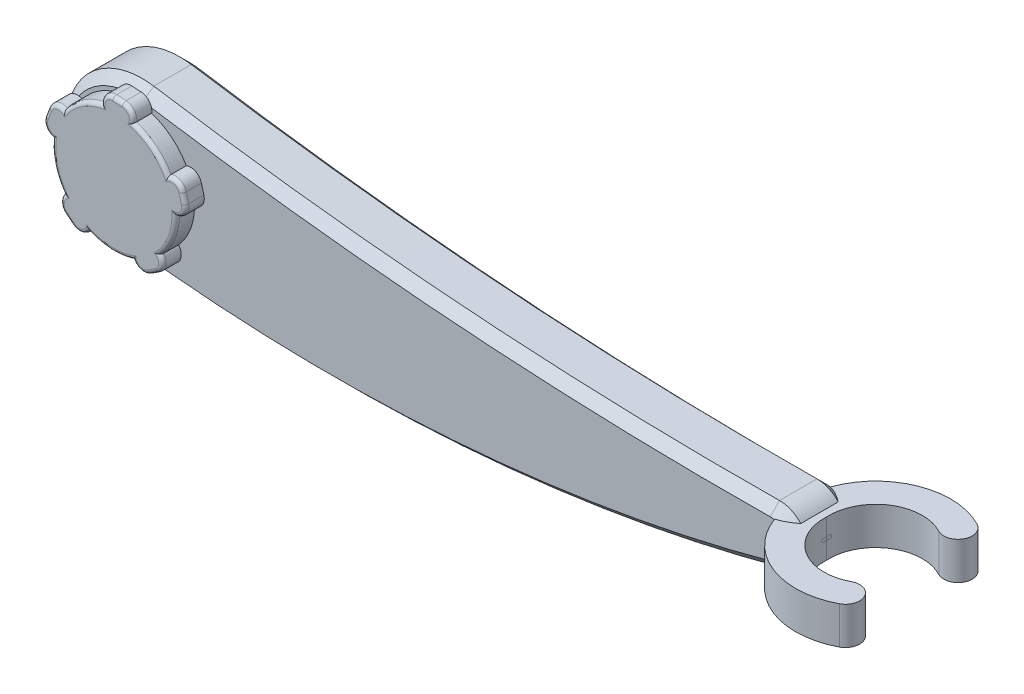
from build123d import *

# Parameters (mm, degrees)
BOSS_EXTRUDE1_DEPTH = 7.5
CHAMFER1_SIZE       = 2.5
SKETCH2_R           = 16.5
BOSS_EXTRUDE2_DEPTH = 5
BOSS_EXTRUDE3_START = -5
BOSS_EXTRUDE3_DEPTH = 5
FILLET2_R           = 1
SKETCH6_R           = 5
BOSS_EXTRUDE4_DEPTH = 10
BOSS_EXTRUDE5_DEPTH = 5


with BuildPart() as part:
    # Sketch1 → Boss-Extrude1 (new, symmetric)
    with BuildSketch(Plane.XY):
        with BuildLine():
            ThreePointArc((-81.871756055, 19.753837344), (-104.803696773, 2.795280684), (-87.461525308, -19.847944306))
            ThreePointArc((-87.461525308, -19.847944306), (0.380210023, -22.09713345), (86.984359422, -7.232725467))
            ThreePointArc((86.984359422, -7.232725467), (92.427584063, 1.039709088), (84.922137279, 7.499595816))
            ThreePointArc((84.922137279, 7.499595816), (1.268561005, 10.133701432), (-81.871756055, 19.753837344))
        make_face()
    extrude(amount=BOSS_EXTRUDE1_DEPTH, both=True)

    # Chamfer1
    chamfer1_edges = [part.edges().sort_by_distance(p)[0] for p in [
        (0.380210023, -22.09713345, 7.5),
        (92.427584063, 1.039709088, 7.5),
        (1.268561005, 10.133701432, 7.5),
        (92.427584063, 1.039709088, -7.5),
        (0.380210023, -22.09713345, -7.5),
        (-104.803696773, 2.795280684, -7.5),
        (1.268561005, 10.133701432, -7.5),
        (-104.803696773, 2.795280684, 7.5),
    ]]
    chamfer(chamfer1_edges, length=CHAMFER1_SIZE)

    # Sketch2 → Boss-Extrude2 (add)
    with BuildSketch(Plane.XY.offset(7.5)):
        with Locations((-85, 0)):
            Circle(SKETCH2_R)
    extrude(amount=BOSS_EXTRUDE2_DEPTH)

    # Sketch4 → Boss-Extrude3 (add)
    with BuildSketch(Plane.XY.offset(12.5).offset(BOSS_EXTRUDE3_START)):
        with BuildLine():
            ThreePointArc((-85.253915773, 19.358335376), (-87.55345676, 18.462340064), (-88.403051231, 16.145254483))
            ThreePointArc((-88.403051231, 16.145254483), (-84.136456722, 16.477387323), (-79.9279524, 15.701093374))
            ThreePointArc((-79.9279524, 15.701093374), (-80.530691308, 18.094292522), (-82.723978156, 19.225746964))
            Line((-82.723978156, 19.225746964), (-85.253915773, 19.358335376))
        make_face()
        with BuildLine():
            ThreePointArc((-70.69655118, 8.225652062), (-69.750616391, 6.301293481), (-69.062223866, 4.270514244))
            Line((-69.062223866, 4.270514244), (-66.339745962, 5))
            Line((-66.339745962, 5), (-66.667593285, 6.223542865))
            ThreePointArc((-66.667593285, 6.223542865), (-68.23033271, 8.133658527), (-70.69655118, 8.225652062))
        make_face()
        with BuildLine():
            Line((-66.339745962, 5), (-69.062223866, 4.270514244))
            ThreePointArc((-69.062223866, 4.270514244), (-68.642999662, 2.167611574), (-68.500023929, 0.028100762))
            ThreePointArc((-68.500023929, 0.028100762), (-66.41021285, 1.340878735), (-66.01189864, 3.776457135))
            Line((-66.01189864, 3.776457135), (-66.339745962, 5))
        make_face()
        with BuildLine():
            ThreePointArc((-73.416033781, -15.511974356), (-72.082318874, -13.435462641), (-72.756931242, -11.061521929))
            ThreePointArc((-72.756931242, -11.061521929), (-76.013455922, -13.838064371), (-79.874501575, -15.683726148))
            ThreePointArc((-79.874501575, -15.683726148), (-77.98018839, -17.265583889), (-75.540729822, -16.891768097))
            Line((-75.540729822, -16.891768097), (-73.416033781, -15.511974356))
        make_face()
        with BuildLine():
            ThreePointArc((-96.173121868, -15.810470249), (-93.786101299, -16.437231094), (-91.736816201, -15.062048582))
            ThreePointArc((-91.736816201, -15.062048582), (-95.383786452, -12.822908364), (-98.332243835, -9.721176591))
            ThreePointArc((-98.332243835, -9.721176591), (-99.25130498, -12.011596414), (-98.141950881, -14.21614395))
            Line((-98.141950881, -14.21614395), (-96.173121868, -15.810470249))
        make_face()
        with BuildLine():
            ThreePointArc((-103.489335293, 5.740566364), (-103.347790357, 3.276695145), (-101.406650146, 1.752663965))
            ThreePointArc((-101.406650146, 1.752663965), (-100.404077037, 5.913071167), (-98.365278262, 9.675708604))
            ThreePointArc((-98.365278262, 9.675708604), (-100.827602472, 9.842009046), (-102.581442501, 8.105707948))
            Line((-102.581442501, 8.105707948), (-103.489335293, 5.740566364))
        make_face()
    extrude(amount=BOSS_EXTRUDE3_DEPTH)

    # Fillet2
    # the kernel refuses this fillet: 1 mm, written as the material it takes off along each edge
    with BuildSketch(Plane(origin=(-100.688594014, 4.665462515, 12.5), x_dir=(-0.9335804264971987, 0.3583679495453081, 0), z_dir=(0.3583679495453081, 0.9335804264971987, 0))) as fillet2_piece_1_section:
        with BuildLine():
            CenterArc((3 - FILLET2_R, -FILLET2_R), FILLET2_R, 0, 90)
            Line((3, -FILLET2_R), (3, 0))
            Line((3, 0), (3 - FILLET2_R, 0))
        make_face()
    fillet2_piece_1 = revolve(axis=Axis((-100.688594014, 4.665462515, 12.5), (0, 0, 1)), revolution_arc=144.920532816, mode=Mode.PRIVATE)
    fillet2_piece_1 = fillet2_piece_1 - Plane(origin=(-85, 0, 12.5), x_dir=(1, 0, 0), z_dir=(0, 0, -1)) * Cylinder(16.5, 13, mode=Mode.PRIVATE)
    add(fillet2_piece_1, mode=Mode.SUBTRACT)
    with BuildSketch(Plane(origin=(-99.780701222, 7.030604099, 12.5), x_dir=(0.9699592561562682, 0.24326742773494928, 0), z_dir=(0.24326742773494928, -0.9699592561562682, 0))) as fillet2_piece_2_section:
        with BuildLine():
            CenterArc((3 - FILLET2_R, -FILLET2_R), FILLET2_R, 0, 90)
            Line((3, -FILLET2_R), (3, 0))
            Line((3, 0), (3 - FILLET2_R, 0))
        make_face()
    fillet2_piece_2 = revolve(axis=Axis((-99.780701222, 7.030604099, 12.5), (0, 0, 1)), revolution_arc=144.920532816, mode=Mode.PRIVATE)
    fillet2_piece_2 = fillet2_piece_2 - Plane(origin=(-85, 0, 12.5), x_dir=(1, 0, 0), z_dir=(0, 0, -1)) * Cylinder(16.5, 13, mode=Mode.PRIVATE)
    add(fillet2_piece_2, mode=Mode.SUBTRACT)
    with BuildSketch(Plane(origin=(-102.581442501, 8.105707948, 12.5), x_dir=(0.9335804264972001, -0.3583679495453047, 0), z_dir=(-0.3583679495453047, -0.9335804264972001, 0)), Plane(origin=(-82.723978156, 19.225746964, 12.5), x_dir=(-0.05233595624295334, -0.9986295347545734, 0), z_dir=(-0.9986295347545734, 0.05233595624295334, 0)), Plane(origin=(-66.01189864, 3.776457135, 12.5), x_dir=(-0.9659258262890675, -0.25881904510252396, 0), z_dir=(-0.25881904510252396, 0.9659258262890674, 0)), Plane(origin=(-75.540729822, -16.891768097, 12.5), x_dir=(-0.5446390350150224, 0.838670567945427, 0), z_dir=(0.8386705679454272, 0.5446390350150224, 0)), Plane(origin=(-98.141950881, -14.21614395, 12.5), x_dir=(0.6293203910498405, 0.7771459614569686, 0), z_dir=(0.7771459614569686, -0.6293203910498405, 0))) as fillet2_piece_3:
        with BuildLine():
            CenterArc((FILLET2_R, -FILLET2_R), FILLET2_R, 90, 90)
            Line((0, -FILLET2_R), (0, 0))
            Line((0, 0), (FILLET2_R, 0))
        make_face()
    extrude(amount=2.533409567, mode=Mode.SUBTRACT)
    with BuildSketch(Plane(origin=(-85, 0, 12.5), x_dir=(-0.05617831402629099, 0.998420751503675, 0), z_dir=(0.998420751503675, 0.05617831402629099, 0))) as fillet2_piece_4_section:
        with BuildLine():
            CenterArc((16.5 - FILLET2_R, -FILLET2_R), FILLET2_R, 0, 90)
            Line((16.5, -FILLET2_R), (16.5, 0))
            Line((16.5, 0), (16.5 - FILLET2_R, 0))
        make_face()
    fillet2_piece_4 = revolve(axis=Axis((-85, 0, 12.5), (0, 0, 1)), revolution_arc=59.559048434, mode=Mode.PRIVATE)
    fillet2_piece_4 = fillet2_piece_4 - Plane(origin=(-99.780701222, 7.030604099, 12.5), x_dir=(0.4718076534887419, 0.8817015017053376, 0), z_dir=(0, 0, -1)) * Cylinder(3, 67, mode=Mode.PRIVATE)
    fillet2_piece_4 = fillet2_piece_4 - Plane(origin=(-85.410923642, 16.362446772, 12.5), x_dir=(0.052335956242956186, 0.9986295347545733, 0), z_dir=(0, 0, -1)) * Cylinder(3, 67, mode=Mode.PRIVATE)
    add(fillet2_piece_4, mode=Mode.SUBTRACT)
    with BuildSketch(Plane(origin=(-85.410923642, 16.362446772, 12.5), x_dir=(0.052335956242956116, 0.9986295347545732, 0), z_dir=(0.9986295347545732, -0.052335956242956116, 0))) as fillet2_piece_5_section:
        with BuildLine():
            CenterArc((3 - FILLET2_R, -FILLET2_R), FILLET2_R, 0, 90)
            Line((3, -FILLET2_R), (3, 0))
            Line((3, 0), (3 - FILLET2_R, 0))
        make_face()
    fillet2_piece_5 = revolve(axis=Axis((-85.410923642, 16.362446772, 12.5), (0, 0, 1)), revolution_arc=144.920532816, mode=Mode.PRIVATE)
    fillet2_piece_5 = fillet2_piece_5 - Plane(origin=(-85, 0, 12.5), x_dir=(1, 0, 0), z_dir=(0, 0, -1)) * Cylinder(16.5, 13, mode=Mode.PRIVATE)
    add(fillet2_piece_5, mode=Mode.SUBTRACT)
    with BuildSketch(Plane(origin=(-82.880986025, 16.22985836, 12.5), x_dir=(0.5310949663532205, -0.847312301760261, 0), z_dir=(-0.847312301760261, -0.5310949663532205, 0))) as fillet2_piece_6_section:
        with BuildLine():
            CenterArc((3 - FILLET2_R, -FILLET2_R), FILLET2_R, 0, 90)
            Line((3, -FILLET2_R), (3, 0))
            Line((3, 0), (3 - FILLET2_R, 0))
        make_face()
    fillet2_piece_6 = revolve(axis=Axis((-82.880986025, 16.22985836, 12.5), (0, 0, 1)), revolution_arc=144.920532816, mode=Mode.PRIVATE)
    fillet2_piece_6 = fillet2_piece_6 - Plane(origin=(-85, 0, 12.5), x_dir=(1, 0, 0), z_dir=(0, 0, -1)) * Cylinder(16.5, 12, mode=Mode.PRIVATE)
    add(fillet2_piece_6, mode=Mode.SUBTRACT)
    with BuildSketch(Plane(origin=(-85, 0, 12.5), x_dir=(0.9321945079724105, 0.3619577313804409, 0), z_dir=(0.3619577313804409, -0.9321945079724105, 0))) as fillet2_piece_7_section:
        with BuildLine():
            CenterArc((16.5 - FILLET2_R, -FILLET2_R), FILLET2_R, 0, 90)
            Line((16.5, -FILLET2_R), (16.5, 0))
            Line((16.5, 0), (16.5 - FILLET2_R, 0))
        make_face()
    fillet2_piece_7 = revolve(axis=Axis((-85, 0, 12.5), (0, 0, 1)), revolution_arc=59.559048434, mode=Mode.PRIVATE)
    fillet2_piece_7 = fillet2_piece_7 - Plane(origin=(-69.565370764, 5.447085729, 12.5), x_dir=(0.9659258262890714, 0.2588190451025092, 0), z_dir=(0, 0, -1)) * Cylinder(3, 67, mode=Mode.PRIVATE)
    fillet2_piece_7 = fillet2_piece_7 - Plane(origin=(-82.880986025, 16.22985836, 12.5), x_dir=(0.9843445416282657, -0.17625499529556493, 0), z_dir=(0, 0, -1)) * Cylinder(3, 67, mode=Mode.PRIVATE)
    add(fillet2_piece_7, mode=Mode.SUBTRACT)
    with BuildSketch(Plane(origin=(-69.565370764, 5.447085729, 12.5), x_dir=(0.9659258262890714, 0.2588190451025092, 0), z_dir=(0.2588190451025092, -0.9659258262890714, 0))) as fillet2_piece_8_section:
        with BuildLine():
            CenterArc((3 - FILLET2_R, -FILLET2_R), FILLET2_R, 0, 90)
            Line((3, -FILLET2_R), (3, 0))
            Line((3, 0), (3 - FILLET2_R, 0))
        make_face()
    fillet2_piece_8 = revolve(axis=Axis((-69.565370764, 5.447085729, 12.5), (0, 0, 1)), revolution_arc=144.920532816, mode=Mode.PRIVATE)
    fillet2_piece_8 = fillet2_piece_8 - Plane(origin=(-85, 0, 12.5), x_dir=(1, 0, 0), z_dir=(0, 0, -1)) * Cylinder(16.5, 12, mode=Mode.PRIVATE)
    add(fillet2_piece_8, mode=Mode.SUBTRACT)
    with BuildSketch(Plane(origin=(-68.909676119, 3, 12.5), x_dir=(-0.6417245156960635, -0.7669352293086118, 0), z_dir=(-0.7669352293086118, 0.6417245156960635, 0))) as fillet2_piece_9_section:
        with BuildLine():
            CenterArc((3 - FILLET2_R, -FILLET2_R), FILLET2_R, 0, 90)
            Line((3, -FILLET2_R), (3, 0))
            Line((3, 0), (3 - FILLET2_R, 0))
        make_face()
    fillet2_piece_9 = revolve(axis=Axis((-68.909676119, 3, 12.5), (0, 0, 1)), revolution_arc=144.920532816, mode=Mode.PRIVATE)
    fillet2_piece_9 = fillet2_piece_9 - Plane(origin=(-85, 0, 12.5), x_dir=(1, 0, 0), z_dir=(0, 0, -1)) * Cylinder(16.5, 12, mode=Mode.PRIVATE)
    add(fillet2_piece_9, mode=Mode.SUBTRACT)
    with BuildSketch(Plane(origin=(-85, 0, 12.5), x_dir=(0.9882829908626626, 0.15263266351456575, 0), z_dir=(-0.15263266351456575, 0.9882829908626626, 0))) as fillet2_piece_10_section:
        with BuildLine():
            CenterArc((16.5 - FILLET2_R, FILLET2_R), FILLET2_R, 270, 90)
            Line((16.5, FILLET2_R), (16.5, 0))
            Line((16.5, 0), (16.5 - FILLET2_R, 0))
        make_face()
    fillet2_piece_10 = revolve(axis=Axis((-85, 0, 12.5), (0, 0, -1)), revolution_arc=59.559048434, mode=Mode.PRIVATE)
    fillet2_piece_10 = fillet2_piece_10 - Plane(origin=(-75.049950886, -12.995962652, 12.5), x_dir=(0.5446390350150236, -0.8386705679454263, 0), z_dir=(0, 0, -1)) * Cylinder(3, 67, mode=Mode.PRIVATE)
    fillet2_piece_10 = fillet2_piece_10 - Plane(origin=(-68.909676119, 3, 12.5), x_dir=(0.13655072987785846, -0.9906330794849444, 0), z_dir=(0, 0, -1)) * Cylinder(3, 67, mode=Mode.PRIVATE)
    add(fillet2_piece_10, mode=Mode.SUBTRACT)
    with BuildSketch(Plane(origin=(-75.049950886, -12.995962652, 12.5), x_dir=(0.5446390350150239, -0.838670567945426, 0), z_dir=(-0.838670567945426, -0.5446390350150239, 0))) as fillet2_piece_11_section:
        with BuildLine():
            CenterArc((3 - FILLET2_R, -FILLET2_R), FILLET2_R, 0, 90)
            Line((3, -FILLET2_R), (3, 0))
            Line((3, 0), (3 - FILLET2_R, 0))
        make_face()
    fillet2_piece_11 = revolve(axis=Axis((-75.049950886, -12.995962652, 12.5), (0, 0, 1)), revolution_arc=144.920532816, mode=Mode.PRIVATE)
    fillet2_piece_11 = fillet2_piece_11 - Plane(origin=(-85, 0, 12.5), x_dir=(1, 0, 0), z_dir=(0, 0, -1)) * Cylinder(16.5, 13, mode=Mode.PRIVATE)
    add(fillet2_piece_11, mode=Mode.SUBTRACT)
    with BuildSketch(Plane(origin=(-77.174646927, -14.375756394, 12.5), x_dir=(-0.9277025284673738, 0.37332026287792297, 0), z_dir=(0.37332026287792297, 0.9277025284673738, 0))) as fillet2_piece_12_section:
        with BuildLine():
            CenterArc((3 - FILLET2_R, -FILLET2_R), FILLET2_R, 0, 90)
            Line((3, -FILLET2_R), (3, 0))
            Line((3, 0), (3 - FILLET2_R, 0))
        make_face()
    fillet2_piece_12 = revolve(axis=Axis((-77.174646927, -14.375756394, 12.5), (0, 0, 1)), revolution_arc=144.920532816, mode=Mode.PRIVATE)
    fillet2_piece_12 = fillet2_piece_12 - Plane(origin=(-85, 0, 12.5), x_dir=(1, 0, 0), z_dir=(0, 0, -1)) * Cylinder(16.5, 12, mode=Mode.PRIVATE)
    add(fillet2_piece_12, mode=Mode.SUBTRACT)
    with BuildSketch(Plane(origin=(-85, 0, 12.5), x_dir=(-0.541407782553995, -0.840760139986409, 0), z_dir=(-0.840760139986409, 0.541407782553995, 0))) as fillet2_piece_13_section:
        with BuildLine():
            CenterArc((16.5 - FILLET2_R, -FILLET2_R), FILLET2_R, 0, 90)
            Line((16.5, -FILLET2_R), (16.5, 0))
            Line((16.5, 0), (16.5 - FILLET2_R, 0))
        make_face()
    fillet2_piece_13 = revolve(axis=Axis((-85, 0, 12.5), (0, 0, 1)), revolution_arc=59.559048434, mode=Mode.PRIVATE)
    fillet2_piece_13 = fillet2_piece_13 - Plane(origin=(-94.285160694, -13.479032365, 12.5), x_dir=(-0.6293203910498562, -0.7771459614569557, 0), z_dir=(0, 0, -1)) * Cylinder(3, 67, mode=Mode.PRIVATE)
    fillet2_piece_13 = fillet2_piece_13 - Plane(origin=(-77.174646927, -14.375756394, 12.5), x_dir=(-0.8999515493751495, -0.4359899182059923, 0), z_dir=(0, 0, -1)) * Cylinder(3, 67, mode=Mode.PRIVATE)
    add(fillet2_piece_13, mode=Mode.SUBTRACT)
    with BuildSketch(Plane(origin=(-94.285160694, -13.479032365, 12.5), x_dir=(-0.6293203910498565, -0.7771459614569555, 0), z_dir=(-0.7771459614569555, 0.6293203910498565, 0))) as fillet2_piece_14_section:
        with BuildLine():
            CenterArc((3 - FILLET2_R, -FILLET2_R), FILLET2_R, 0, 90)
            Line((3 - FILLET2_R, 0), (3, 0))
            Line((3, 0), (3, -FILLET2_R))
        make_face()
    fillet2_piece_14 = revolve(axis=Axis((-94.285160694, -13.479032365, 12.5), (0, 0, 1)), revolution_arc=144.920532816, mode=Mode.PRIVATE)
    fillet2_piece_14 = fillet2_piece_14 - Plane(origin=(-85, 0, 12.5), x_dir=(1, 0, 0), z_dir=(0, 0, -1)) * Cylinder(16.5, 12, mode=Mode.PRIVATE)
    add(fillet2_piece_14, mode=Mode.SUBTRACT)
    with BuildSketch(Plane(origin=(-96.253989708, -11.884706065, 12.5), x_dir=(0.06837282165402307, 0.9976598404561883, 0), z_dir=(0.9976598404561883, -0.06837282165402307, 0))) as fillet2_piece_15_section:
        with BuildLine():
            CenterArc((3 - FILLET2_R, -FILLET2_R), FILLET2_R, 0, 90)
            Line((3, -FILLET2_R), (3, 0))
            Line((3, 0), (3 - FILLET2_R, 0))
        make_face()
    fillet2_piece_15 = revolve(axis=Axis((-96.253989708, -11.884706065, 12.5), (0, 0, 1)), revolution_arc=144.920532816, mode=Mode.PRIVATE)
    fillet2_piece_15 = fillet2_piece_15 - Plane(origin=(-85, 0, 12.5), x_dir=(1, 0, 0), z_dir=(0, 0, -1)) * Cylinder(16.5, 13, mode=Mode.PRIVATE)
    add(fillet2_piece_15, mode=Mode.SUBTRACT)
    with BuildSketch(Plane(origin=(-85, 0, 12.5), x_dir=(-0.9669146154713397, 0.2551002281220293, 0), z_dir=(0.2551002281220293, 0.9669146154713397, 0))) as fillet2_piece_16_section:
        with BuildLine():
            CenterArc((16.5 - FILLET2_R, -FILLET2_R), FILLET2_R, 0, 90)
            Line((16.5, -FILLET2_R), (16.5, 0))
            Line((16.5, 0), (16.5 - FILLET2_R, 0))
        make_face()
    fillet2_piece_16 = revolve(axis=Axis((-85, 0, 12.5), (0, 0, 1)), revolution_arc=59.559048434, mode=Mode.PRIVATE)
    fillet2_piece_16 = fillet2_piece_16 - Plane(origin=(-96.253989708, -11.884706065, 12.5), x_dir=(-0.6927513756198016, 0.7211764912813456, 0), z_dir=(0, 0, -1)) * Cylinder(3, 67, mode=Mode.PRIVATE)
    fillet2_piece_16 = fillet2_piece_16 - Plane(origin=(-100.688594014, 4.665462515, 12.5), x_dir=(-0.9335804264971987, 0.3583679495453081, 0), z_dir=(0, 0, -1)) * Cylinder(3, 67, mode=Mode.PRIVATE)
    add(fillet2_piece_16, mode=Mode.SUBTRACT)
    with BuildSketch(Plane(origin=(-100.688594014, 4.665462515, 12.5), x_dir=(-0.9335804264971987, 0.3583679495453081, 0), z_dir=(0.3583679495453081, 0.9335804264971987, 0))) as fillet2_piece_17a_section:
        with BuildLine():
            CenterArc((3 - FILLET2_R, -FILLET2_R), FILLET2_R, 0, 90)
            Line((3, -FILLET2_R), (3, 0))
            Line((3, 0), (3 - FILLET2_R, 0))
        make_face()
    fillet2_piece_17a = revolve(axis=Axis((-100.688594014, 4.665462515, 12.5), (0, 0, 1)), revolution_arc=144.920532816, mode=Mode.PRIVATE)
    fillet2_piece_17a = fillet2_piece_17a & Plane(origin=(-85, 0, 12.5), x_dir=(1, 0, 0), z_dir=(0, 0, -1)) * Cylinder(16.5, 13, mode=Mode.PRIVATE)
    with BuildSketch(Plane(origin=(-85, 0, 12.5), x_dir=(-0.9669146154713397, 0.2551002281220293, 0), z_dir=(0.2551002281220293, 0.9669146154713397, 0))) as fillet2_piece_17b_section:
        with BuildLine():
            CenterArc((16.5 - FILLET2_R, -FILLET2_R), FILLET2_R, 0, 90)
            Line((16.5, -FILLET2_R), (16.5, 0))
            Line((16.5, 0), (16.5 - FILLET2_R, 0))
        make_face()
    fillet2_piece_17b = revolve(axis=Axis((-85, 0, 12.5), (0, 0, 1)), revolution_arc=59.559048434, mode=Mode.PRIVATE)
    fillet2_piece_17b = fillet2_piece_17b & Plane(origin=(-100.688594014, 4.665462515, 12.5), x_dir=(-0.9335804264971987, 0.3583679495453081, 0), z_dir=(0, 0, -1)) * Cylinder(3, 67, mode=Mode.PRIVATE)
    fillet2_piece_17 = fillet2_piece_17a & fillet2_piece_17b
    add(fillet2_piece_17, mode=Mode.SUBTRACT)
    with BuildSketch(Plane(origin=(-85, 0, 12.5), x_dir=(-0.05617831402629099, 0.998420751503675, 0), z_dir=(0.998420751503675, 0.05617831402629099, 0))) as fillet2_piece_18a_section:
        with BuildLine():
            CenterArc((16.5 - FILLET2_R, -FILLET2_R), FILLET2_R, 0, 90)
            Line((16.5, -FILLET2_R), (16.5, 0))
            Line((16.5, 0), (16.5 - FILLET2_R, 0))
        make_face()
    fillet2_piece_18a = revolve(axis=Axis((-85, 0, 12.5), (0, 0, 1)), revolution_arc=59.559048434, mode=Mode.PRIVATE)
    fillet2_piece_18a = fillet2_piece_18a & Plane(origin=(-99.780701222, 7.030604099, 12.5), x_dir=(0.4718076534887419, 0.8817015017053376, 0), z_dir=(0, 0, -1)) * Cylinder(3, 67, mode=Mode.PRIVATE)
    with BuildSketch(Plane(origin=(-99.780701222, 7.030604099, 12.5), x_dir=(0.9699592561562682, 0.24326742773494928, 0), z_dir=(0.24326742773494928, -0.9699592561562682, 0))) as fillet2_piece_18b_section:
        with BuildLine():
            CenterArc((3 - FILLET2_R, -FILLET2_R), FILLET2_R, 0, 90)
            Line((3, -FILLET2_R), (3, 0))
            Line((3, 0), (3 - FILLET2_R, 0))
        make_face()
    fillet2_piece_18b = revolve(axis=Axis((-99.780701222, 7.030604099, 12.5), (0, 0, 1)), revolution_arc=144.920532816, mode=Mode.PRIVATE)
    fillet2_piece_18b = fillet2_piece_18b & Plane(origin=(-85, 0, 12.5), x_dir=(1, 0, 0), z_dir=(0, 0, -1)) * Cylinder(16.5, 13, mode=Mode.PRIVATE)
    fillet2_piece_18 = fillet2_piece_18a & fillet2_piece_18b
    add(fillet2_piece_18, mode=Mode.SUBTRACT)
    with BuildSketch(Plane(origin=(-85.410923642, 16.362446772, 12.5), x_dir=(0.052335956242956116, 0.9986295347545732, 0), z_dir=(0.9986295347545732, -0.052335956242956116, 0))) as fillet2_piece_19a_section:
        with BuildLine():
            CenterArc((3 - FILLET2_R, -FILLET2_R), FILLET2_R, 0, 90)
            Line((3, -FILLET2_R), (3, 0))
            Line((3, 0), (3 - FILLET2_R, 0))
        make_face()
    fillet2_piece_19a = revolve(axis=Axis((-85.410923642, 16.362446772, 12.5), (0, 0, 1)), revolution_arc=144.920532816, mode=Mode.PRIVATE)
    fillet2_piece_19a = fillet2_piece_19a & Plane(origin=(-85, 0, 12.5), x_dir=(1, 0, 0), z_dir=(0, 0, -1)) * Cylinder(16.5, 13, mode=Mode.PRIVATE)
    with BuildSketch(Plane(origin=(-85, 0, 12.5), x_dir=(-0.05617831402629099, 0.998420751503675, 0), z_dir=(0.998420751503675, 0.05617831402629099, 0))) as fillet2_piece_19b_section:
        with BuildLine():
            CenterArc((16.5 - FILLET2_R, -FILLET2_R), FILLET2_R, 0, 90)
            Line((16.5, -FILLET2_R), (16.5, 0))
            Line((16.5, 0), (16.5 - FILLET2_R, 0))
        make_face()
    fillet2_piece_19b = revolve(axis=Axis((-85, 0, 12.5), (0, 0, 1)), revolution_arc=59.559048434, mode=Mode.PRIVATE)
    fillet2_piece_19b = fillet2_piece_19b & Plane(origin=(-85.410923642, 16.362446772, 12.5), x_dir=(0.052335956242956186, 0.9986295347545733, 0), z_dir=(0, 0, -1)) * Cylinder(3, 67, mode=Mode.PRIVATE)
    fillet2_piece_19 = fillet2_piece_19a & fillet2_piece_19b
    add(fillet2_piece_19, mode=Mode.SUBTRACT)
    with BuildSketch(Plane(origin=(-82.880986025, 16.22985836, 12.5), x_dir=(0.5310949663532205, -0.847312301760261, 0), z_dir=(-0.847312301760261, -0.5310949663532205, 0))) as fillet2_piece_20a_section:
        with BuildLine():
            CenterArc((3 - FILLET2_R, -FILLET2_R), FILLET2_R, 0, 90)
            Line((3, -FILLET2_R), (3, 0))
            Line((3, 0), (3 - FILLET2_R, 0))
        make_face()
    fillet2_piece_20a = revolve(axis=Axis((-82.880986025, 16.22985836, 12.5), (0, 0, 1)), revolution_arc=144.920532816, mode=Mode.PRIVATE)
    fillet2_piece_20a = fillet2_piece_20a & Plane(origin=(-85, 0, 12.5), x_dir=(1, 0, 0), z_dir=(0, 0, -1)) * Cylinder(16.5, 12, mode=Mode.PRIVATE)
    with BuildSketch(Plane(origin=(-85, 0, 12.5), x_dir=(0.9321945079724105, 0.3619577313804409, 0), z_dir=(0.3619577313804409, -0.9321945079724105, 0))) as fillet2_piece_20b_section:
        with BuildLine():
            CenterArc((16.5 - FILLET2_R, -FILLET2_R), FILLET2_R, 0, 90)
            Line((16.5, -FILLET2_R), (16.5, 0))
            Line((16.5, 0), (16.5 - FILLET2_R, 0))
        make_face()
    fillet2_piece_20b = revolve(axis=Axis((-85, 0, 12.5), (0, 0, 1)), revolution_arc=59.559048434, mode=Mode.PRIVATE)
    fillet2_piece_20b = fillet2_piece_20b & Plane(origin=(-82.880986025, 16.22985836, 12.5), x_dir=(0.9843445416282657, -0.17625499529556493, 0), z_dir=(0, 0, -1)) * Cylinder(3, 67, mode=Mode.PRIVATE)
    fillet2_piece_20 = fillet2_piece_20a & fillet2_piece_20b
    add(fillet2_piece_20, mode=Mode.SUBTRACT)
    with BuildSketch(Plane(origin=(-69.565370764, 5.447085729, 12.5), x_dir=(0.9659258262890714, 0.2588190451025092, 0), z_dir=(0.2588190451025092, -0.9659258262890714, 0))) as fillet2_piece_21a_section:
        with BuildLine():
            CenterArc((3 - FILLET2_R, -FILLET2_R), FILLET2_R, 0, 90)
            Line((3, -FILLET2_R), (3, 0))
            Line((3, 0), (3 - FILLET2_R, 0))
        make_face()
    fillet2_piece_21a = revolve(axis=Axis((-69.565370764, 5.447085729, 12.5), (0, 0, 1)), revolution_arc=144.920532816, mode=Mode.PRIVATE)
    fillet2_piece_21a = fillet2_piece_21a & Plane(origin=(-85, 0, 12.5), x_dir=(1, 0, 0), z_dir=(0, 0, -1)) * Cylinder(16.5, 12, mode=Mode.PRIVATE)
    with BuildSketch(Plane(origin=(-85, 0, 12.5), x_dir=(0.9321945079724105, 0.3619577313804409, 0), z_dir=(0.3619577313804409, -0.9321945079724105, 0))) as fillet2_piece_21b_section:
        with BuildLine():
            CenterArc((16.5 - FILLET2_R, -FILLET2_R), FILLET2_R, 0, 90)
            Line((16.5, -FILLET2_R), (16.5, 0))
            Line((16.5, 0), (16.5 - FILLET2_R, 0))
        make_face()
    fillet2_piece_21b = revolve(axis=Axis((-85, 0, 12.5), (0, 0, 1)), revolution_arc=59.559048434, mode=Mode.PRIVATE)
    fillet2_piece_21b = fillet2_piece_21b & Plane(origin=(-69.565370764, 5.447085729, 12.5), x_dir=(0.9659258262890714, 0.2588190451025092, 0), z_dir=(0, 0, -1)) * Cylinder(3, 67, mode=Mode.PRIVATE)
    fillet2_piece_21 = fillet2_piece_21a & fillet2_piece_21b
    add(fillet2_piece_21, mode=Mode.SUBTRACT)
    with BuildSketch(Plane(origin=(-85, 0, 12.5), x_dir=(0.9882829908626626, 0.15263266351456575, 0), z_dir=(-0.15263266351456575, 0.9882829908626626, 0))) as fillet2_piece_22a_section:
        with BuildLine():
            CenterArc((16.5 - FILLET2_R, FILLET2_R), FILLET2_R, 270, 90)
            Line((16.5, FILLET2_R), (16.5, 0))
            Line((16.5, 0), (16.5 - FILLET2_R, 0))
        make_face()
    fillet2_piece_22a = revolve(axis=Axis((-85, 0, 12.5), (0, 0, -1)), revolution_arc=59.559048434, mode=Mode.PRIVATE)
    fillet2_piece_22a = fillet2_piece_22a & Plane(origin=(-68.909676119, 3, 12.5), x_dir=(0.13655072987785846, -0.9906330794849444, 0), z_dir=(0, 0, -1)) * Cylinder(3, 67, mode=Mode.PRIVATE)
    with BuildSketch(Plane(origin=(-68.909676119, 3, 12.5), x_dir=(-0.6417245156960635, -0.7669352293086118, 0), z_dir=(-0.7669352293086118, 0.6417245156960635, 0))) as fillet2_piece_22b_section:
        with BuildLine():
            CenterArc((3 - FILLET2_R, -FILLET2_R), FILLET2_R, 0, 90)
            Line((3, -FILLET2_R), (3, 0))
            Line((3, 0), (3 - FILLET2_R, 0))
        make_face()
    fillet2_piece_22b = revolve(axis=Axis((-68.909676119, 3, 12.5), (0, 0, 1)), revolution_arc=144.920532816, mode=Mode.PRIVATE)
    fillet2_piece_22b = fillet2_piece_22b & Plane(origin=(-85, 0, 12.5), x_dir=(1, 0, 0), z_dir=(0, 0, -1)) * Cylinder(16.5, 12, mode=Mode.PRIVATE)
    fillet2_piece_22 = fillet2_piece_22a & fillet2_piece_22b
    add(fillet2_piece_22, mode=Mode.SUBTRACT)
    with BuildSketch(Plane(origin=(-75.049950886, -12.995962652, 12.5), x_dir=(0.5446390350150239, -0.838670567945426, 0), z_dir=(-0.838670567945426, -0.5446390350150239, 0))) as fillet2_piece_23a_section:
        with BuildLine():
            CenterArc((3 - FILLET2_R, -FILLET2_R), FILLET2_R, 0, 90)
            Line((3, -FILLET2_R), (3, 0))
            Line((3, 0), (3 - FILLET2_R, 0))
        make_face()
    fillet2_piece_23a = revolve(axis=Axis((-75.049950886, -12.995962652, 12.5), (0, 0, 1)), revolution_arc=144.920532816, mode=Mode.PRIVATE)
    fillet2_piece_23a = fillet2_piece_23a & Plane(origin=(-85, 0, 12.5), x_dir=(1, 0, 0), z_dir=(0, 0, -1)) * Cylinder(16.5, 13, mode=Mode.PRIVATE)
    with BuildSketch(Plane(origin=(-85, 0, 12.5), x_dir=(0.9882829908626626, 0.15263266351456575, 0), z_dir=(-0.15263266351456575, 0.9882829908626626, 0))) as fillet2_piece_23b_section:
        with BuildLine():
            CenterArc((16.5 - FILLET2_R, FILLET2_R), FILLET2_R, 270, 90)
            Line((16.5, FILLET2_R), (16.5, 0))
            Line((16.5, 0), (16.5 - FILLET2_R, 0))
        make_face()
    fillet2_piece_23b = revolve(axis=Axis((-85, 0, 12.5), (0, 0, -1)), revolution_arc=59.559048434, mode=Mode.PRIVATE)
    fillet2_piece_23b = fillet2_piece_23b & Plane(origin=(-75.049950886, -12.995962652, 12.5), x_dir=(0.5446390350150236, -0.8386705679454263, 0), z_dir=(0, 0, -1)) * Cylinder(3, 67, mode=Mode.PRIVATE)
    fillet2_piece_23 = fillet2_piece_23a & fillet2_piece_23b
    add(fillet2_piece_23, mode=Mode.SUBTRACT)
    with BuildSketch(Plane(origin=(-85, 0, 12.5), x_dir=(-0.541407782553995, -0.840760139986409, 0), z_dir=(-0.840760139986409, 0.541407782553995, 0))) as fillet2_piece_24a_section:
        with BuildLine():
            CenterArc((16.5 - FILLET2_R, -FILLET2_R), FILLET2_R, 0, 90)
            Line((16.5, -FILLET2_R), (16.5, 0))
            Line((16.5, 0), (16.5 - FILLET2_R, 0))
        make_face()
    fillet2_piece_24a = revolve(axis=Axis((-85, 0, 12.5), (0, 0, 1)), revolution_arc=59.559048434, mode=Mode.PRIVATE)
    fillet2_piece_24a = fillet2_piece_24a & Plane(origin=(-77.174646927, -14.375756394, 12.5), x_dir=(-0.8999515493751495, -0.4359899182059923, 0), z_dir=(0, 0, -1)) * Cylinder(3, 67, mode=Mode.PRIVATE)
    with BuildSketch(Plane(origin=(-77.174646927, -14.375756394, 12.5), x_dir=(-0.9277025284673738, 0.37332026287792297, 0), z_dir=(0.37332026287792297, 0.9277025284673738, 0))) as fillet2_piece_24b_section:
        with BuildLine():
            CenterArc((3 - FILLET2_R, -FILLET2_R), FILLET2_R, 0, 90)
            Line((3, -FILLET2_R), (3, 0))
            Line((3, 0), (3 - FILLET2_R, 0))
        make_face()
    fillet2_piece_24b = revolve(axis=Axis((-77.174646927, -14.375756394, 12.5), (0, 0, 1)), revolution_arc=144.920532816, mode=Mode.PRIVATE)
    fillet2_piece_24b = fillet2_piece_24b & Plane(origin=(-85, 0, 12.5), x_dir=(1, 0, 0), z_dir=(0, 0, -1)) * Cylinder(16.5, 12, mode=Mode.PRIVATE)
    fillet2_piece_24 = fillet2_piece_24a & fillet2_piece_24b
    add(fillet2_piece_24, mode=Mode.SUBTRACT)
    with BuildSketch(Plane(origin=(-94.285160694, -13.479032365, 12.5), x_dir=(-0.6293203910498565, -0.7771459614569555, 0), z_dir=(-0.7771459614569555, 0.6293203910498565, 0))) as fillet2_piece_25a_section:
        with BuildLine():
            CenterArc((3 - FILLET2_R, -FILLET2_R), FILLET2_R, 0, 90)
            Line((3 - FILLET2_R, 0), (3, 0))
            Line((3, 0), (3, -FILLET2_R))
        make_face()
    fillet2_piece_25a = revolve(axis=Axis((-94.285160694, -13.479032365, 12.5), (0, 0, 1)), revolution_arc=144.920532816, mode=Mode.PRIVATE)
    fillet2_piece_25a = fillet2_piece_25a & Plane(origin=(-85, 0, 12.5), x_dir=(1, 0, 0), z_dir=(0, 0, -1)) * Cylinder(16.5, 12, mode=Mode.PRIVATE)
    with BuildSketch(Plane(origin=(-85, 0, 12.5), x_dir=(-0.541407782553995, -0.840760139986409, 0), z_dir=(-0.840760139986409, 0.541407782553995, 0))) as fillet2_piece_25b_section:
        with BuildLine():
            CenterArc((16.5 - FILLET2_R, -FILLET2_R), FILLET2_R, 0, 90)
            Line((16.5, -FILLET2_R), (16.5, 0))
            Line((16.5, 0), (16.5 - FILLET2_R, 0))
        make_face()
    fillet2_piece_25b = revolve(axis=Axis((-85, 0, 12.5), (0, 0, 1)), revolution_arc=59.559048434, mode=Mode.PRIVATE)
    fillet2_piece_25b = fillet2_piece_25b & Plane(origin=(-94.285160694, -13.479032365, 12.5), x_dir=(-0.6293203910498562, -0.7771459614569557, 0), z_dir=(0, 0, -1)) * Cylinder(3, 67, mode=Mode.PRIVATE)
    fillet2_piece_25 = fillet2_piece_25a & fillet2_piece_25b
    add(fillet2_piece_25, mode=Mode.SUBTRACT)
    with BuildSketch(Plane(origin=(-85, 0, 12.5), x_dir=(-0.9669146154713397, 0.2551002281220293, 0), z_dir=(0.2551002281220293, 0.9669146154713397, 0))) as fillet2_piece_26a_section:
        with BuildLine():
            CenterArc((16.5 - FILLET2_R, -FILLET2_R), FILLET2_R, 0, 90)
            Line((16.5, -FILLET2_R), (16.5, 0))
            Line((16.5, 0), (16.5 - FILLET2_R, 0))
        make_face()
    fillet2_piece_26a = revolve(axis=Axis((-85, 0, 12.5), (0, 0, 1)), revolution_arc=59.559048434, mode=Mode.PRIVATE)
    fillet2_piece_26a = fillet2_piece_26a & Plane(origin=(-96.253989708, -11.884706065, 12.5), x_dir=(-0.6927513756198016, 0.7211764912813456, 0), z_dir=(0, 0, -1)) * Cylinder(3, 67, mode=Mode.PRIVATE)
    with BuildSketch(Plane(origin=(-96.253989708, -11.884706065, 12.5), x_dir=(0.06837282165402307, 0.9976598404561883, 0), z_dir=(0.9976598404561883, -0.06837282165402307, 0))) as fillet2_piece_26b_section:
        with BuildLine():
            CenterArc((3 - FILLET2_R, -FILLET2_R), FILLET2_R, 0, 90)
            Line((3, -FILLET2_R), (3, 0))
            Line((3, 0), (3 - FILLET2_R, 0))
        make_face()
    fillet2_piece_26b = revolve(axis=Axis((-96.253989708, -11.884706065, 12.5), (0, 0, 1)), revolution_arc=144.920532816, mode=Mode.PRIVATE)
    fillet2_piece_26b = fillet2_piece_26b & Plane(origin=(-85, 0, 12.5), x_dir=(1, 0, 0), z_dir=(0, 0, -1)) * Cylinder(16.5, 13, mode=Mode.PRIVATE)
    fillet2_piece_26 = fillet2_piece_26a & fillet2_piece_26b
    add(fillet2_piece_26, mode=Mode.SUBTRACT)

    # Sketch6 → Boss-Extrude4 (add)
    with BuildSketch(Plane(origin=(0, 0, -7.5), x_dir=(-1, 0, 0), z_dir=(0, 0, -1))):
        with Locations(Location((85, 0, 0), (0, 0, 180))):
            Circle(SKETCH6_R)
    extrude(amount=BOSS_EXTRUDE4_DEPTH)


with BuildPart() as boss_extrude5_tool:
    # Sketch7 → Boss-Extrude5 (new, symmetric)
    with BuildSketch(Plane(origin=(0, 0, 0), x_dir=(1, 0, 0), z_dir=(0, 1, 0))):
        with BuildLine():
            ThreePointArc((84.922137279, 0), (94.310174815, 17.630690371), (114.271785043, 18.345259351))
            ThreePointArc((114.271785043, 18.345259351), (115.845259351, 13.228214957), (110.728214957, 11.654740649))
            ThreePointArc((110.728214957, 11.654740649), (98.215582654, 11.14272164), (92.5, 0))
            ThreePointArc((92.5, 0), (98.215582654, -11.14272164), (110.728214957, -11.654740649))
            ThreePointArc((110.728214957, -11.654740649), (115.845259351, -13.228214957), (114.271785043, -18.345259351))
            ThreePointArc((114.271785043, -18.345259351), (94.310174815, -17.630690371), (84.922137279, 0))
        make_face()
    extrude(amount=BOSS_EXTRUDE5_DEPTH, both=True)


with BuildPart() as part_1:
    add(part.part)


with BuildPart() as part_2:
    # Boss-Extrude5: joined with boss_extrude5_tool
    add(part_1.part.fuse(boss_extrude5_tool.part, tol=0.00001))


solid = part_2.part
